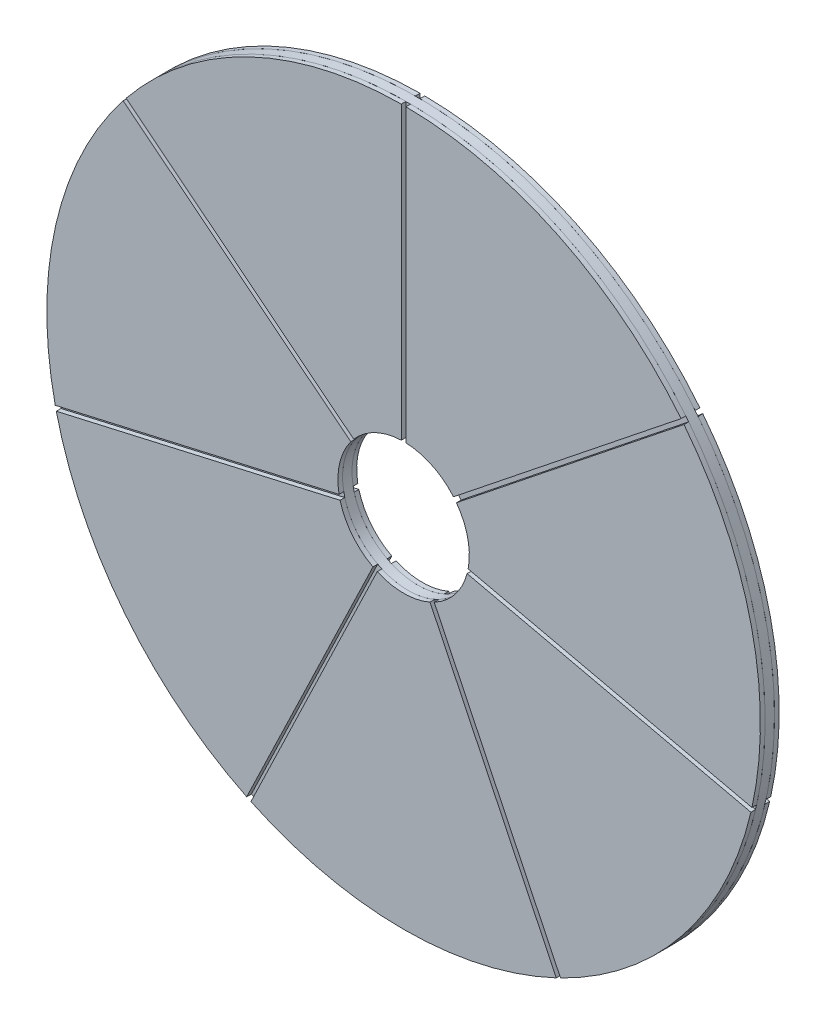
from build123d import *

# Parameters (mm, degrees)
BOSS_EXTRUDE1_DEPTH      = 0.25
BOSS_EXTRUDE1_DEPTH_BACK = 0.25
SKETCH1_R                = 19
BOSS_EXTRUDE2_DEPTH      = 0.25
BOSS_EXTRUDE2_2_DEPTH    = 0.25
BOSS_EXTRUDE2_3_DEPTH    = 0.25
BOSS_EXTRUDE2_4_DEPTH    = 0.25
BOSS_EXTRUDE2_5_DEPTH    = 0.25
BOSS_EXTRUDE2_6_DEPTH    = 0.25
BOSS_EXTRUDE2_7_DEPTH    = 0.25
CUT_EXTRUDE2_DEPTH       = 10
CUT_EXTRUDE2_DEPTH_BACK  = 8.35
SKETCH3_R                = 3.5


with BuildPart() as part:
    # Sketch1 → Boss-Extrude1 (new, two sides: drawn at the far end of the back side and taken through both)
    with BuildSketch(Plane.XY.offset(-BOSS_EXTRUDE1_DEPTH_BACK)):
        Circle(SKETCH1_R)
    extrude(amount=BOSS_EXTRUDE1_DEPTH + BOSS_EXTRUDE1_DEPTH_BACK)


with BuildPart() as body_2:
    # Sketch2 → Boss-Extrude2 (new body)
    with BuildSketch(Plane.XY.offset(0.25)):
        with BuildLine():
            Line((0.125, 18.999588811), (0.125, 0.259565175))
            Line((0.125, 0.259565175), (14.776540461, 11.943778799))
            ThreePointArc((14.776540461, 11.943778799), (8.243791043, 17.11840849), (0.125, 18.999588811))
        make_face()
    extrude(amount=BOSS_EXTRUDE2_DEPTH)


with BuildPart() as body_3:
    # Sketch2 → Boss-Extrude2 2 (new body)
    with BuildSketch(Plane.XY.offset(0.25)):
        with BuildLine():
            Line((-14.776540461, 11.943778799), (-0.125, 0.259565175))
            Line((-0.125, 0.259565175), (-0.125, 18.999588811))
            ThreePointArc((-0.125, 18.999588811), (-8.243791043, 17.11840849), (-14.776540461, 11.943778799))
        make_face()
    extrude(amount=BOSS_EXTRUDE2_2_DEPTH)


with BuildPart() as body_4:
    # Sketch2 → Boss-Extrude2 3 (new body)
    with BuildSketch(Plane.XY.offset(0.25)):
        with BuildLine():
            Line((-18.551044569, -4.105940258), (-0.28087245, 0.064107304))
            Line((-0.28087245, 0.064107304), (-14.932412912, 11.748320928))
            ThreePointArc((-14.932412912, 11.748320928), (-18.523630331, 4.227897745), (-18.551044569, -4.105940258))
        make_face()
    extrude(amount=BOSS_EXTRUDE2_3_DEPTH)


with BuildPart() as body_5:
    # Sketch2 → Boss-Extrude2 4 (new body)
    with BuildSketch(Plane.XY.offset(0.25)):
        with BuildLine():
            Line((14.932412912, 11.748320928), (0.28087245, 0.064107304))
            Line((0.28087245, 0.064107304), (18.551044569, -4.105940258))
            ThreePointArc((18.551044569, -4.105940258), (18.523630331, 4.227897745), (14.932412912, 11.748320928))
        make_face()
    extrude(amount=BOSS_EXTRUDE2_4_DEPTH)


with BuildPart() as body_6:
    # Sketch2 → Boss-Extrude2 5 (new body)
    with BuildSketch(Plane.XY.offset(0.25)):
        with BuildLine():
            Line((18.495414335, -4.349672236), (0.225242217, -0.179624674))
            Line((0.225242217, -0.179624674), (8.356233744, -17.063802555))
            ThreePointArc((8.356233744, -17.063802555), (14.854798167, -11.846306235), (18.495414335, -4.349672236))
        make_face()
    extrude(amount=BOSS_EXTRUDE2_5_DEPTH)


with BuildPart() as body_7:
    # Sketch2 → Boss-Extrude2 6 (new body)
    with BuildSketch(Plane.XY.offset(0.25)):
        with BuildLine():
            Line((8.130991527, -17.172273489), (0, -0.288095609))
            Line((0, -0.288095609), (-8.130991527, -17.172273489))
            ThreePointArc((-8.130991527, -17.172273489), (0, -19), (8.130991527, -17.172273489))
        make_face()
    extrude(amount=BOSS_EXTRUDE2_6_DEPTH)


with BuildPart() as body_8:
    # Sketch2 → Boss-Extrude2 7 (new body)
    with BuildSketch(Plane.XY.offset(0.25)):
        with BuildLine():
            Line((-8.356233744, -17.063802555), (-0.225242217, -0.179624674))
            Line((-0.225242217, -0.179624674), (-18.495414335, -4.349672236))
            ThreePointArc((-18.495414335, -4.349672236), (-14.854798167, -11.846306235), (-8.356233744, -17.063802555))
        make_face()
    extrude(amount=BOSS_EXTRUDE2_7_DEPTH)


with BuildPart() as body_9:
    # Mirror5: mirrored copy
    add(body_2.part.mirror(Plane.XY))


with BuildPart() as body_10:
    # Mirror5 2: mirrored copy
    add(body_3.part.mirror(Plane.XY))


with BuildPart() as body_11:
    # Mirror5 3: mirrored copy
    add(body_5.part.mirror(Plane.XY))


with BuildPart() as body_12:
    # Mirror5 4: mirrored copy
    add(body_6.part.mirror(Plane.XY))


with BuildPart() as body_13:
    # Mirror5 5: mirrored copy
    add(body_7.part.mirror(Plane.XY))


with BuildPart() as body_14:
    # Mirror5 6: mirrored copy
    add(body_8.part.mirror(Plane.XY))


with BuildPart() as body_15:
    # Mirror5 7: mirrored copy
    add(body_4.part.mirror(Plane.XY))


with BuildPart() as cut_extrude2_tool:
    # Sketch3 → Cut-Extrude2 (new, two sides: drawn at the far end of the back side and taken through both)
    with BuildSketch(Plane.XY.offset(-CUT_EXTRUDE2_DEPTH_BACK)):
        Circle(SKETCH3_R)
    extrude(amount=CUT_EXTRUDE2_DEPTH + CUT_EXTRUDE2_DEPTH_BACK)


with BuildPart() as part_1:
    add(part.part)

    # Cut-Extrude2: cut by cut_extrude2_tool
    add(cut_extrude2_tool.part, mode=Mode.SUBTRACT)


with BuildPart() as body_2_1:
    add(body_2.part)

    # Cut-Extrude2: cut by cut_extrude2_tool
    add(cut_extrude2_tool.part, mode=Mode.SUBTRACT)


with BuildPart() as body_3_1:
    add(body_3.part)

    # Cut-Extrude2: cut by cut_extrude2_tool
    add(cut_extrude2_tool.part, mode=Mode.SUBTRACT)


with BuildPart() as body_4_1:
    add(body_4.part)

    # Cut-Extrude2: cut by cut_extrude2_tool
    add(cut_extrude2_tool.part, mode=Mode.SUBTRACT)


with BuildPart() as body_5_1:
    add(body_5.part)

    # Cut-Extrude2: cut by cut_extrude2_tool
    add(cut_extrude2_tool.part, mode=Mode.SUBTRACT)


with BuildPart() as body_6_1:
    add(body_6.part)

    # Cut-Extrude2: cut by cut_extrude2_tool
    add(cut_extrude2_tool.part, mode=Mode.SUBTRACT)


with BuildPart() as body_7_1:
    add(body_7.part)

    # Cut-Extrude2: cut by cut_extrude2_tool
    add(cut_extrude2_tool.part, mode=Mode.SUBTRACT)


with BuildPart() as body_8_1:
    add(body_8.part)

    # Cut-Extrude2: cut by cut_extrude2_tool
    add(cut_extrude2_tool.part, mode=Mode.SUBTRACT)


with BuildPart() as body_9_1:
    add(body_9.part)

    # Cut-Extrude2: cut by cut_extrude2_tool
    add(cut_extrude2_tool.part, mode=Mode.SUBTRACT)


with BuildPart() as body_10_1:
    add(body_10.part)

    # Cut-Extrude2: cut by cut_extrude2_tool
    add(cut_extrude2_tool.part, mode=Mode.SUBTRACT)


with BuildPart() as body_11_1:
    add(body_11.part)

    # Cut-Extrude2: cut by cut_extrude2_tool
    add(cut_extrude2_tool.part, mode=Mode.SUBTRACT)


with BuildPart() as body_12_1:
    add(body_12.part)

    # Cut-Extrude2: cut by cut_extrude2_tool
    add(cut_extrude2_tool.part, mode=Mode.SUBTRACT)


with BuildPart() as body_13_1:
    add(body_13.part)

    # Cut-Extrude2: cut by cut_extrude2_tool
    add(cut_extrude2_tool.part, mode=Mode.SUBTRACT)


with BuildPart() as body_14_1:
    add(body_14.part)

    # Cut-Extrude2: cut by cut_extrude2_tool
    add(cut_extrude2_tool.part, mode=Mode.SUBTRACT)


with BuildPart() as body_15_1:
    add(body_15.part)

    # Cut-Extrude2: cut by cut_extrude2_tool
    add(cut_extrude2_tool.part, mode=Mode.SUBTRACT)


solid = Compound([part_1.part, body_2_1.part, body_3_1.part, body_4_1.part, body_5_1.part, body_6_1.part, body_7_1.part, body_8_1.part, body_9_1.part, body_10_1.part, body_11_1.part, body_12_1.part, body_13_1.part, body_14_1.part, body_15_1.part])
